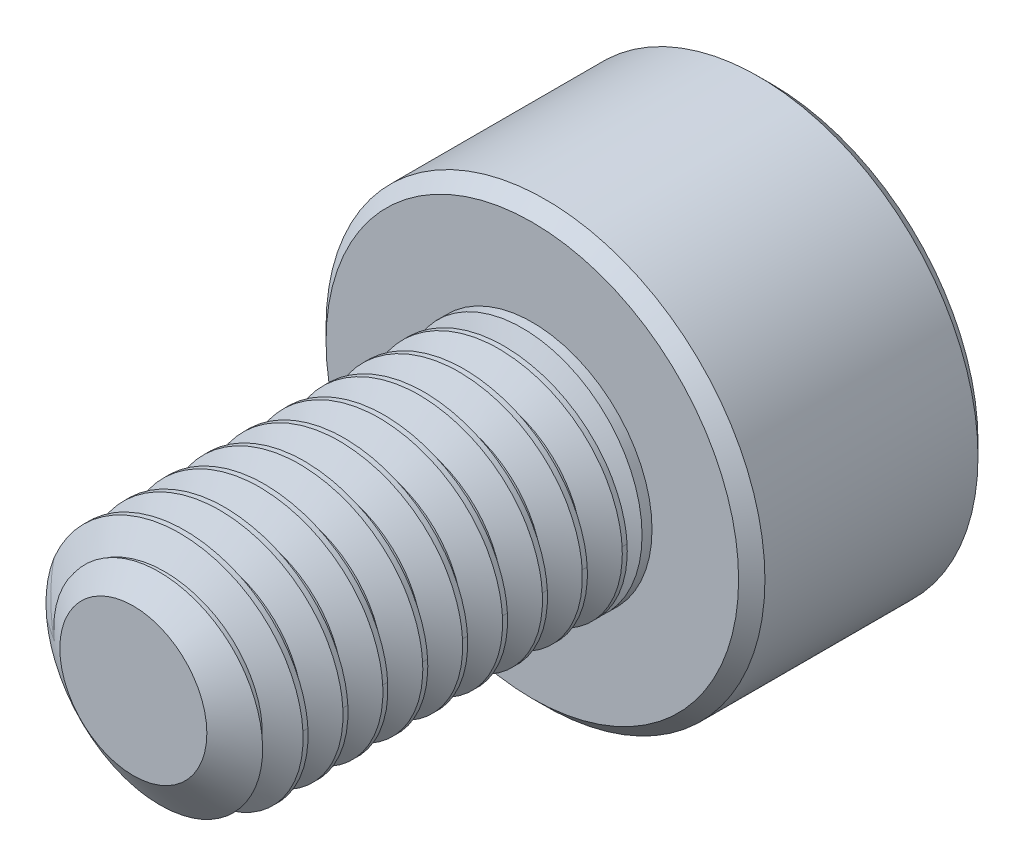
from build123d import *

# Parameters (mm, degrees)
SKETCH1_R          = 1.5
EXTRUDE1_DEPTH     = 5
CUT_SWEEP1_PITCH   = 0.5
SKETCH6_R          = 2.75
EXTRUDE2_DEPTH     = 3
CUT_EXTRUDE1_DEPTH = 1.875
CHAMFER1_SIZE      = 0.165


with BuildPart() as part:
    # Sketch1 → Extrude1 (new body)
    with BuildSketch(Plane.XY):
        Circle(SKETCH1_R)
    extrude(amount=-EXTRUDE1_DEPTH)

    # Cut-Sweep1: the profile of Sketch3 profile screwed along a right-hand helix of 11 turns, 6 arcs to a turn; built about Z, then put on its axis
    cut_sweep1_z = Axis((0, 0, 0), (0, 0, 1))
    cut_sweep1_corners = [(1.5003, 0, -0.437673205), (1.175240474, 0, -0.25), (1.175240474, 0, -0.1875), (1.5003, 0, 0.000173205)]
    with BuildLine(mode=Mode.PRIVATE) as cut_sweep1_profile:
        Line(cut_sweep1_corners[0], cut_sweep1_corners[1])
        Line(cut_sweep1_corners[1], cut_sweep1_corners[2])
        Line(cut_sweep1_corners[2], cut_sweep1_corners[3])
        Line(cut_sweep1_corners[3], cut_sweep1_corners[0])
    cut_sweep1_cap = Face(cut_sweep1_profile.wire())
    cut_sweep1_turn_angles = [0, 30, 60, 90, 120, 150, 180, 210, 240, 270, 300, 330, 360]
    cut_sweep1_turn_weights = [1, 0.8660254037844387, 1, 0.8660254037844387, 1, 0.8660254037844387, 1, 0.8660254037844387, 1, 0.8660254037844387, 1, 0.8660254037844387, 1]
    cut_sweep1_turn_rails = [Edge.make_bspline([Vector(p[0], p[1], 0).rotate(cut_sweep1_z, cut_sweep1_turn_angles[k]) / cut_sweep1_turn_weights[k] + Vector(0, 0, p[2] + CUT_SWEEP1_PITCH * cut_sweep1_turn_angles[k] / 360) for k in range(13)], [0, 0, 0, 1, 1, 2, 2, 3, 3, 4, 4, 5, 5, 6, 6, 6], 2, cut_sweep1_turn_weights) for p in cut_sweep1_corners]
    cut_sweep1_turn_sides = [Face.make_surface_from_curves(cut_sweep1_turn_rails[p[0]], cut_sweep1_turn_rails[p[1]]) for p in [(0, 1), (1, 2), (2, 3), (3, 0)]]
    cut_sweep1 = Plane(origin=(0, 0, 0), x_dir=(0, 1, 0), z_dir=(0, 0, -1)) * Solid(Shell([*[p.moved(Location((0, 0, CUT_SWEEP1_PITCH * i))) for i in range(11) for p in cut_sweep1_turn_sides], cut_sweep1_cap, cut_sweep1_cap.rotate(cut_sweep1_z, 3960).moved(Location((0, 0, CUT_SWEEP1_PITCH * 3960 / 360)))]))
    add(cut_sweep1, mode=Mode.SUBTRACT)

    # Sketch4 → Cut-Revolve1 (revolve, cut)
    with BuildSketch(Plane(origin=(0, 0, 0), x_dir=(0, 0, -1), z_dir=(1, 0, 0)), mode=Mode.PRIVATE) as cut_revolve1_sk:
        Polygon((0.405251783, 1.5), (0, 0.921240474), (0, 1.5), align=None)
    revolve(cut_revolve1_sk.sketch.rotate(Axis((0, 0, 0), (0, 0, -1)), 263.352109169), axis=Axis((0, 0, 0), (0, 0, -1)), mode=Mode.SUBTRACT)

    # Sketch6 → Extrude2 (add)
    with BuildSketch(Plane(origin=(0, 0, -5), x_dir=(-1, 0, 0), z_dir=(0, 0, -1))):
        Circle(SKETCH6_R)
    extrude(amount=EXTRUDE2_DEPTH)

    # Sketch7 → Cut-Extrude1 (cut)
    with BuildSketch(Plane(origin=(0, 0, -8), x_dir=(-1, 0, 0), z_dir=(0, 0, -1))):
        Polygon((0, 1.443375673), (-1.25, 0.721687836), (-1.25, -0.721687836), (0, -1.443375673), (1.25, -0.721687836), (1.25, 0.721687836), align=None)
    extrude(amount=-CUT_EXTRUDE1_DEPTH, mode=Mode.SUBTRACT)

    # Cut-Extrude2 cone 1 section (through the dimple's axis) → Cut-Extrude2 (revolve, cut)
    with BuildSketch(Plane(origin=(0, 0, -8), x_dir=(0, 1, 0), z_dir=(1, 0, 0))):
        Polygon((0, 0), (1.443375673, 0), (0, 1.443375673), align=None)
    revolve(axis=Axis((0, 0, -8), (0, 0, 1)), mode=Mode.SUBTRACT)

    # Chamfer1
    chamfer1_edges = [part.edges().sort_by_distance(p)[0] for p in [
        (2.75, 0, -5),
        (2.75, 0, -8),
    ]]
    chamfer(chamfer1_edges, length=CHAMFER1_SIZE)

    # Sketch10 → Revolve1 (revolve)
    with BuildSketch(Plane(origin=(0, 0, 0), x_dir=(0, 0, -1), z_dir=(1, 0, 0)), mode=Mode.PRIVATE) as revolve1_sk:
        Polygon((5, 1.5), (5, 0), (4.253679656, 0), (4.875, 1.5), align=None)
    revolve(revolve1_sk.sketch.rotate(Axis((0, 0, -5), (0, 0, 1)), 270), axis=Axis((0, 0, -5), (0, 0, 1)))


solid = part.part
